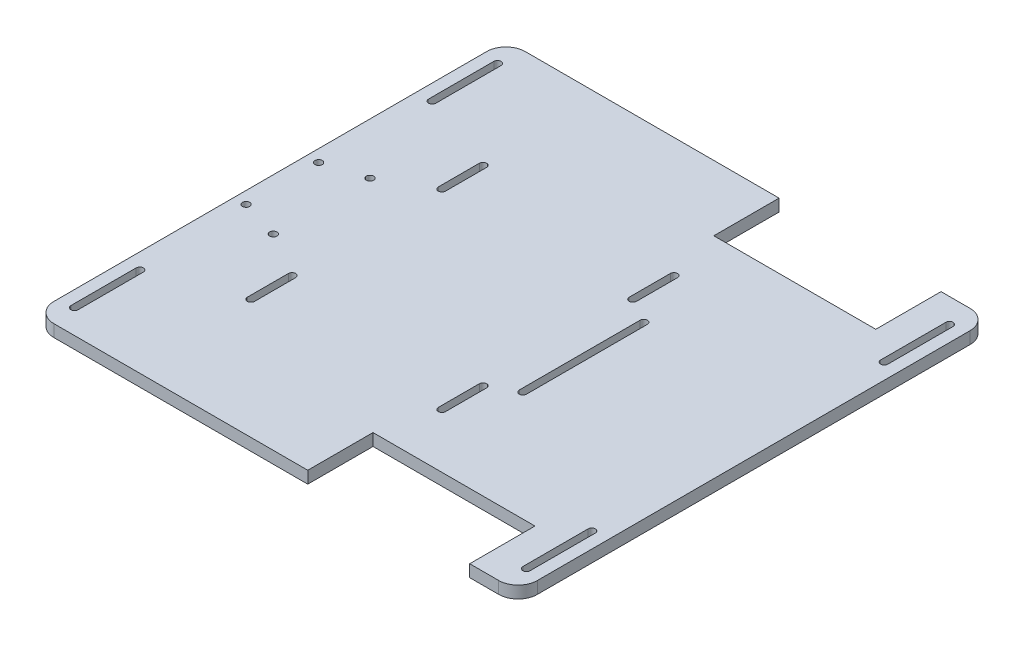
from build123d import *

# Parameters (mm, degrees)
SKETCH2_W           = 200
SKETCH2_H           = 195
BOSS_EXTRUDE1_DEPTH = 5
CUT_EXTRUDE1_DEPTH  = 140.754248594
SKETCH4_W           = 67
SKETCH4_H           = 27
CUT_EXTRUDE2_DEPTH  = 140.754248594
CUT_EXTRUDE4_DEPTH  = 140.754248594
CUT_EXTRUDE5_DEPTH  = 140.754248594
SKETCH8_R           = 1.5
CUT_EXTRUDE6_DEPTH  = 140.754248594
SKETCH9_R           = 1.5
CUT_EXTRUDE7_DEPTH  = 140.754248594
FILLET1_R           = 8


with BuildPart() as part:
    # Sketch2 → Boss-Extrude1 (new body)
    with BuildSketch(Plane(origin=(0, 0, 0), x_dir=(1, 0, 0), z_dir=(0, 1, 0))):
        Rectangle(SKETCH2_W, SKETCH2_H)
    extrude(amount=BOSS_EXTRUDE1_DEPTH)

    # Sketch3 → Cut-Extrude1 (cut, through all)
    with BuildSketch(Plane(origin=(0, 5, 0), x_dir=(1, 0, 0), z_dir=(0, 1, 0))):
        with BuildLine():
            Line((-95, -87.5), (-95, -60.5))
            ThreePointArc((-95, -60.5), (-93.5, -59), (-92, -60.5))
            Line((-92, -60.5), (-92, -87.5))
            ThreePointArc((-92, -87.5), (-93.5, -89), (-95, -87.5))
        make_face()
        with BuildLine():
            Line((-95, 87.5), (-95, 60.5))
            ThreePointArc((-95, 60.5), (-93.5, 59), (-92, 60.5))
            Line((-92, 60.5), (-92, 87.5))
            ThreePointArc((-92, 87.5), (-93.5, 89), (-95, 87.5))
        make_face()
        with BuildLine():
            Line((95, 87.5), (95, 60.5))
            ThreePointArc((95, 60.5), (93.5, 59), (92, 60.5))
            Line((92, 60.5), (92, 87.5))
            ThreePointArc((92, 87.5), (93.5, 89), (95, 87.5))
        make_face()
        with BuildLine():
            Line((95, -87.5), (95, -60.5))
            ThreePointArc((95, -60.5), (93.5, -59), (92, -60.5))
            Line((92, -60.5), (92, -87.5))
            ThreePointArc((92, -87.5), (93.5, -89), (95, -87.5))
        make_face()
    extrude(amount=-CUT_EXTRUDE1_DEPTH, mode=Mode.SUBTRACT)

    # Sketch4 → Cut-Extrude2 (cut, through all)
    with BuildSketch(Plane.XZ):
        with Locations((46.5, -84)):
            Rectangle(SKETCH4_W, SKETCH4_H)
        with Locations((46.5, 84)):
            Rectangle(SKETCH4_W, SKETCH4_H)
    extrude(amount=-CUT_EXTRUDE2_DEPTH, mode=Mode.SUBTRACT)

    # Sketch5 → Cut-Extrude4 (cut, through all)
    with BuildSketch(Plane.XZ):
        with BuildLine():
            Line((-61.5, -48), (-61.5, -31))
            ThreePointArc((-61.5, -31), (-60, -29.5), (-58.5, -31))
            Line((-58.5, -31), (-58.5, -48))
            ThreePointArc((-58.5, -48), (-60, -49.5), (-61.5, -48))
        make_face()
        with BuildLine():
            Line((-61.5, 48), (-61.5, 31))
            ThreePointArc((-61.5, 31), (-60, 29.5), (-58.5, 31))
            Line((-58.5, 31), (-58.5, 48))
            ThreePointArc((-58.5, 48), (-60, 49.5), (-61.5, 48))
        make_face()
        with BuildLine():
            Line((20.5, 48), (20.5, 31))
            ThreePointArc((20.5, 31), (19, 29.5), (17.5, 31))
            Line((17.5, 31), (17.5, 48))
            ThreePointArc((17.5, 48), (19, 49.5), (20.5, 48))
        make_face()
        with BuildLine():
            Line((20.5, -48), (20.5, -31))
            ThreePointArc((20.5, -31), (19, -29.5), (17.5, -31))
            Line((17.5, -31), (17.5, -48))
            ThreePointArc((17.5, -48), (19, -49.5), (20.5, -48))
        make_face()
    extrude(amount=-CUT_EXTRUDE4_DEPTH, mode=Mode.SUBTRACT)

    # Sketch7 → Cut-Extrude5 (cut, through all)
    with BuildSketch(Plane.XZ):
        with BuildLine():
            Line((28, -25), (28, 25))
            ThreePointArc((28, 25), (29.5, 26.5), (31, 25))
            Line((31, 25), (31, -25))
            ThreePointArc((31, -25), (29.5, -26.5), (28, -25))
        make_face()
    extrude(amount=-CUT_EXTRUDE5_DEPTH, mode=Mode.SUBTRACT)

    # Sketch8 → Cut-Extrude6 (cut, through all)
    with BuildSketch(Plane(origin=(0, 5, 0), x_dir=(1, 0, 0), z_dir=(0, 1, 0))):
        with Locations((-78.75, -19.995)):
            Circle(SKETCH8_R)
        with Locations((-78.75, 19.995)):
            Circle(SKETCH8_R)
    extrude(amount=-CUT_EXTRUDE6_DEPTH, mode=Mode.SUBTRACT)

    # Sketch9 → Cut-Extrude7 (cut, through all)
    with BuildSketch(Plane(origin=(0, 5, 0), x_dir=(1, 0, 0), z_dir=(0, 1, 0))):
        with Locations((-95, 15)):
            Circle(SKETCH9_R)
        with Locations((-95, -15)):
            Circle(SKETCH9_R)
    extrude(amount=-CUT_EXTRUDE7_DEPTH, mode=Mode.SUBTRACT)

    # Fillet1
    fillet1_edges = [part.edges().sort_by_distance(p)[0] for p in [
        (100, 2.5, -97.5),
        (100, 2.5, 97.5),
        (-100, 2.5, -97.5),
        (-100, 2.5, 97.5),
    ]]
    fillet(fillet1_edges, radius=FILLET1_R)


solid = part.part
